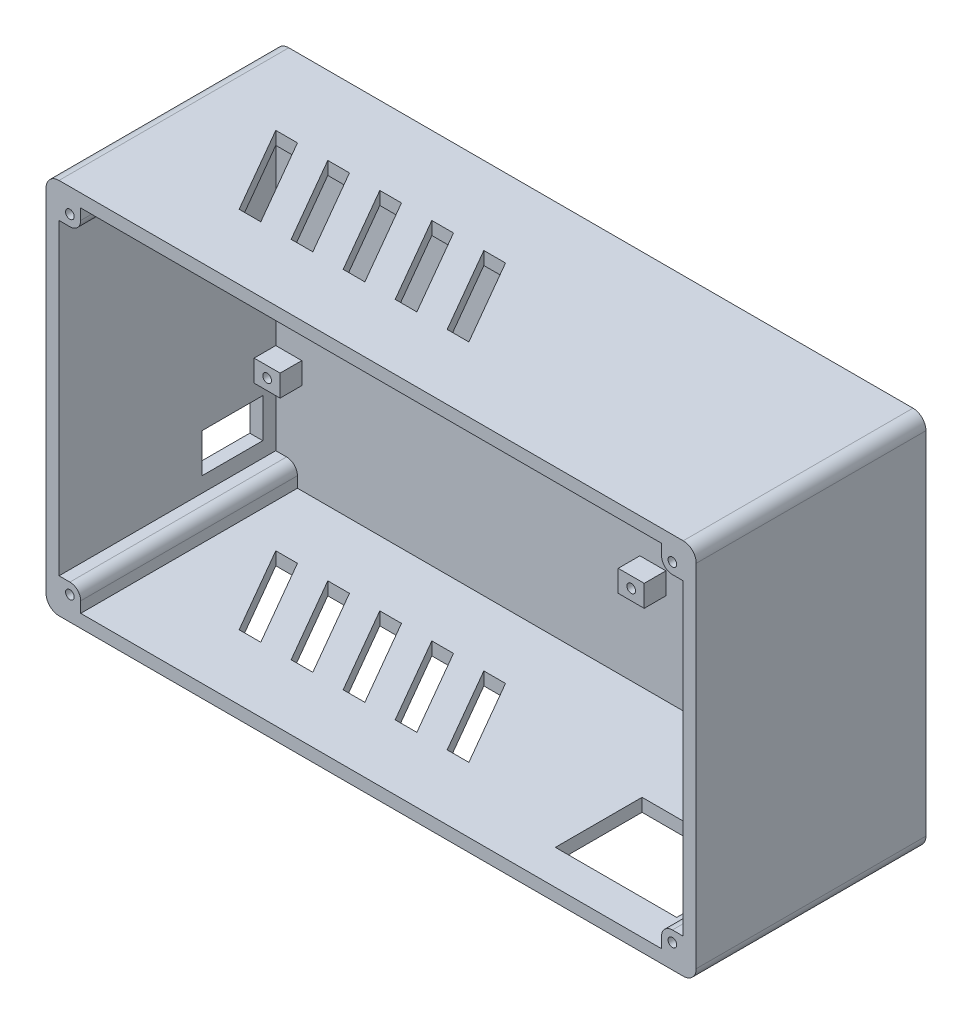
from build123d import *

# Parameters (mm, degrees)
SKETCH1_W               = 150
SKETCH1_H               = 87
BODY_FRAME_DEPTH        = 53
BODY_EDGES_R            = 3
SHELL1_START            = 3
SHELL1_OUTLINE_W        = 81
SHELL1_OUTLINE_H        = 50
SHELL1_DEPTH            = 144
SKETCH3_R               = 1
SCREW_HOLE_DEPTH        = 50
MIRROR2_COPY_1_SKETCH_R = 1
MIRROR2_COPY_1_DEPTH    = 50
SKETCH4_W               = 6
SKETCH4_H               = 5
SKETCH4_R               = 1
BOSS_EXTRUDE3_DEPTH     = 5
SKETCH5_W               = 14
SKETCH5_H               = 9
SWITCH_DEPTH            = 179.849098404
SKETCH6_W               = 28
SKETCH6_H               = 20
AC_IN_DEPTH             = 3
SKETCH8_W               = 8
SKETCH8_H               = 13
PROGRAM_PORT_DEPTH      = 3
CUT_EXTRUDE1_DEPTH      = 182.322916367
LPATTERN1_COUNT         = 5
LPATTERN1_PITCH         = 12


# Read off the part's stored shape, not the designer's step: Shell1
with BuildPart() as part:
    # Sketch1 → Body_frame (new body)
    with BuildSketch(Plane.XY):
        with Locations((75, 43.5)):
            Rectangle(SKETCH1_W, SKETCH1_H)
    extrude(amount=BODY_FRAME_DEPTH)

    # body_edges
    body_edges_edges = [part.edges().sort_by_distance(p)[0] for p in [
        (0, 87, 26.5),
        (150, 87, 26.5),
        (150, 0, 26.5),
        (0, 0, 26.5),
    ]]
    fillet(body_edges_edges, radius=BODY_EDGES_R)

    # Shell1 outline → Shell1 (cut)
    with BuildSketch(Plane.YZ.offset(SHELL1_START)):
        with Locations((43.5, 28)):
            Rectangle(SHELL1_OUTLINE_W, SHELL1_OUTLINE_H)
    extrude(amount=SHELL1_DEPTH, mode=Mode.SUBTRACT)

    # Sketch3 → screw_hole (add)
    with BuildSketch(Plane.XY.offset(3)):
        with BuildLine():
            Line((3, 84), (8, 84))
            Line((8, 84), (8, 81.5))
            ThreePointArc((8, 81.5), (7.267766953, 79.732233047), (5.5, 79))
            Line((5.5, 79), (3, 79))
            Line((3, 79), (3, 84))
        make_face()
        with Locations((5.5, 81.5)):
            Circle(SKETCH3_R, mode=Mode.SUBTRACT)
    screw_hole = extrude(amount=SCREW_HOLE_DEPTH)

    # Mirror1: screw_hole across plane
    add(screw_hole.mirror(Plane.ZY.offset(-75)))

    # Mirror2: screw_hole across plane
    add(screw_hole.mirror(Plane.ZX.offset(43.5)))

    # Mirror2 copy 1 sketch → Mirror2 copy 1 (add)
    with BuildSketch(Plane(origin=(150, 87, 3), x_dir=(-1, 0, 0), z_dir=(0, 0, 1))):
        with BuildLine():
            Line((3, 84), (8, 84))
            Line((8, 84), (8, 81.5))
            ThreePointArc((8, 81.5), (7.267766953, 79.732233047), (5.5, 79))
            Line((5.5, 79), (3, 79))
            Line((3, 79), (3, 84))
        make_face()
        with Locations((5.5, 81.5)):
            Circle(MIRROR2_COPY_1_SKETCH_R, mode=Mode.SUBTRACT)
    extrude(amount=MIRROR2_COPY_1_DEPTH)

    # Sketch4 → Boss-Extrude3 (add)
    # profile 1 of 4: a face of its own
    with BuildSketch(Plane.XY.offset(3)):
        with Locations((6, 76.5)):
            Rectangle(SKETCH4_W, SKETCH4_H)
        with Locations((6, 76.5)):
            Circle(SKETCH4_R, mode=Mode.SUBTRACT)
    # profile 2 of 4: a face of its own
    with BuildSketch(Plane.XY.offset(3)):
        with Locations((90, 76.5)):
            Rectangle(SKETCH4_W, SKETCH4_H)
        with Locations((90, 76.5)):
            Circle(SKETCH4_R, mode=Mode.SUBTRACT)
    # profile 3 of 4: a face of its own
    with BuildSketch(Plane.XY.offset(3)):
        with Locations((6, 26.5)):
            Rectangle(SKETCH4_W, SKETCH4_H)
        with Locations((6, 26.5)):
            Circle(SKETCH4_R, mode=Mode.SUBTRACT)
    # profile 4 of 4: a face of its own
    with BuildSketch(Plane.XY.offset(3)):
        with Locations((90, 26.5)):
            Rectangle(SKETCH4_W, SKETCH4_H)
        with Locations((90, 26.5)):
            Circle(SKETCH4_R, mode=Mode.SUBTRACT)
    extrude(amount=BOSS_EXTRUDE3_DEPTH)

    # Sketch5 → switch (cut, through all)
    with BuildSketch(Plane(origin=(3, 0, 0), x_dir=(0, 0, -1), z_dir=(1, 0, 0))):
        with Locations((-13, 16)):
            Rectangle(SKETCH5_W, SKETCH5_H)
    extrude(amount=-SWITCH_DEPTH, mode=Mode.SUBTRACT)

    # Sketch6 → AC_IN (cut)
    with BuildSketch(Plane.XZ):
        with Locations((123.5, 35)):
            Rectangle(SKETCH6_W, SKETCH6_H)
    extrude(amount=-AC_IN_DEPTH, mode=Mode.SUBTRACT)

    # Sketch8 → Program_port (cut)
    with BuildSketch(Plane.ZY):
        with Locations((18.5, 64)):
            Rectangle(SKETCH8_W, SKETCH8_H)
    extrude(amount=-PROGRAM_PORT_DEPTH, mode=Mode.SUBTRACT)

    # Sketch9 → Cut-Extrude1 (cut, through all)
    with BuildSketch(Plane.XZ):
        Polygon((18, 18), (23, 18), (34.547005384, 38), (29.547005384, 38), align=None)
    cut_extrude1 = extrude(amount=-CUT_EXTRUDE1_DEPTH, mode=Mode.SUBTRACT)

    # LPattern1: Cut-Extrude1 ×5
    with Locations(*[(i * LPATTERN1_PITCH, 0, 0) for i in range(1, LPATTERN1_COUNT)]):
        add(cut_extrude1, mode=Mode.SUBTRACT)


solid = part.part
